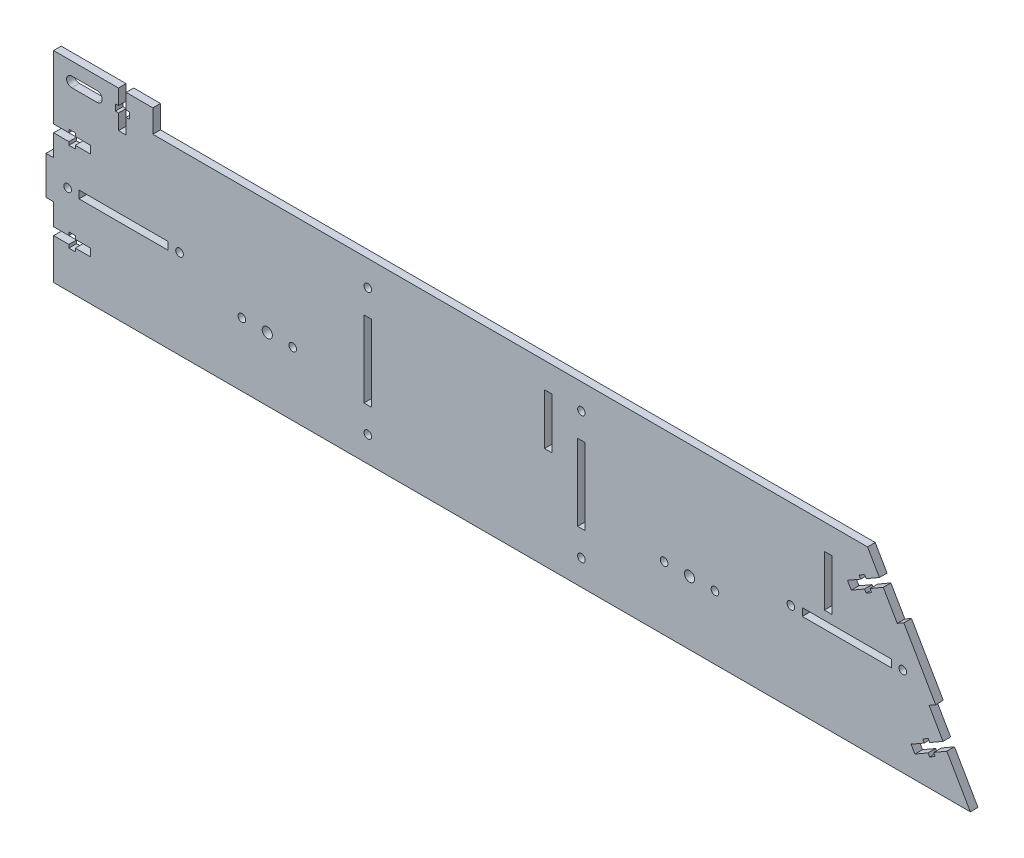
from build123d import *

# Parameters (mm, degrees)
SKETCH_1_R             = 2
SKETCH_1_R_2           = 1.5
EXTRUDE_1_DEPTH        = 3
SKETCH_2_W             = 19
SKETCH_2_H             = 3
EXTRUDE_2_DEPTH        = 3
PATTERN_LINEAR_1_COUNT = 9
PATTERN_LINEAR_1_PITCH = 28
SKETCH_3_W             = 3
SKETCH_3_H             = 30
CUT_EXTRUDE_1_DEPTH    = 3
SKETCH_4_W             = 35
SKETCH_4_H             = 3
CUT_EXTRUDE_2_DEPTH    = 3
SKETCH_5_R             = 1.5
CUT_EXTRUDE_3_DEPTH    = 3
CUT_EXTRUDE_4_DEPTH    = 3
CUT_EXTRUDE_5_DEPTH    = 3
SKETCH_8_W             = 39
SKETCH_8_H             = 3
EXTRUDE_3_DEPTH        = 9
SKETCH_11_W            = 3
SKETCH_11_H            = 25
EXTRUDE_5_DEPTH        = 3
SKETCH_12_W            = 3
SKETCH_12_H            = 15
EXTRUDE_6_DEPTH        = 3
SKETCH_13_W            = 243
SKETCH_13_H            = 3
CUT_EXTRUDE_7_DEPTH    = 3
SKETCH_14_W            = 3
SKETCH_14_H            = 20
CUT_EXTRUDE_8_DEPTH    = 10
CUT_EXTRUDE_9_DEPTH    = 3
CUT_EXTRUDE_10_DEPTH   = 10


with BuildPart() as part:
    # Эскиз1 → Бобышка-Вытянуть1 (new body)
    with BuildSketch(Plane.XY):
        Polygon((320, 70), (360.414518843, 0), (0, 0), (0, 70), align=None)
        with Locations((84, 25)):
            Circle(SKETCH_1_R, mode=Mode.SUBTRACT)
        with Locations((250, 25)):
            Circle(SKETCH_1_R, mode=Mode.SUBTRACT)
        with Locations((94, 25)):
            Circle(SKETCH_1_R_2, mode=Mode.SUBTRACT)
        with Locations((74, 25)):
            Circle(SKETCH_1_R_2, mode=Mode.SUBTRACT)
        with Locations((240, 25)):
            Circle(SKETCH_1_R_2, mode=Mode.SUBTRACT)
        with Locations((260, 25)):
            Circle(SKETCH_1_R_2, mode=Mode.SUBTRACT)
    extrude(amount=EXTRUDE_1_DEPTH)

    # Эскиз2 → Бобышка-Вытянуть2 (add)
    with BuildSketch(Plane(origin=(0, 70, 0), x_dir=(1, 0, 0), z_dir=(0, 1, 0))):
        with Locations((291.5, -1.5)):
            Rectangle(SKETCH_2_W, SKETCH_2_H)
    extrude_2 = extrude(amount=EXTRUDE_2_DEPTH)

    # Линейный массив1: Бобышка-Вытянуть2 ×9
    with Locations(*[(-i * PATTERN_LINEAR_1_PITCH, 0, 0) for i in range(1, PATTERN_LINEAR_1_COUNT)]):
        add(extrude_2)

    # Эскиз3 → Вырез-Вытянуть1 (cut)
    with BuildSketch(Plane.XY.offset(3)):
        with Locations((207.5, 35)):
            Rectangle(SKETCH_3_W, SKETCH_3_H)
        with Locations((123.5, 35)):
            Rectangle(SKETCH_3_W, SKETCH_3_H)
    extrude(amount=-CUT_EXTRUDE_1_DEPTH, mode=Mode.SUBTRACT)

    # Эскиз4 → Вырез-Вытянуть2 (cut)
    with BuildSketch(Plane.XY.offset(3)):
        with Locations((311.841234018, 35)):
            Rectangle(SKETCH_4_W, SKETCH_4_H)
        with Locations((27.5, 35)):
            Rectangle(SKETCH_4_W, SKETCH_4_H)
    extrude(amount=-CUT_EXTRUDE_2_DEPTH, mode=Mode.SUBTRACT)

    # Эскиз5 → Вырез-Вытянуть3 (cut)
    with BuildSketch(Plane.XY.offset(3)):
        with Locations((5.5, 35)):
            Circle(SKETCH_5_R)
        with Locations((49.5, 35)):
            Circle(SKETCH_5_R)
        with Locations((123.5, 60)):
            Circle(SKETCH_5_R)
        with Locations((123.5, 10)):
            Circle(SKETCH_5_R)
        with Locations((207.5, 60)):
            Circle(SKETCH_5_R)
        with Locations((207.5, 10)):
            Circle(SKETCH_5_R)
        with Locations((289.841234018, 35)):
            Circle(SKETCH_5_R)
        with Locations((333.841234018, 35)):
            Circle(SKETCH_5_R)
    extrude(amount=-CUT_EXTRUDE_3_DEPTH, mode=Mode.SUBTRACT)

    # Эскиз6 → Вырез-Вытянуть4 (cut)
    with BuildSketch(Plane.XY.offset(3)):
        Polygon((0, 54), (6, 54), (6, 55.25), (8.5, 55.25), (8.5, 54), (14.5, 54), (14.5, 51), (8.5, 51), (8.5, 49.75), (6, 49.75), (6, 51), (0, 51), align=None)
        Polygon((0, 19), (6, 19), (6, 20.25), (8.5, 20.25), (8.5, 19), (14.5, 19), (14.5, 16), (8.5, 16), (8.5, 14.75), (6, 14.75), (6, 16), (0, 16), align=None)
    extrude(amount=-CUT_EXTRUDE_4_DEPTH, mode=Mode.SUBTRACT)

    # Эскиз7 → Вырез-Вытянуть5 (cut)
    with BuildSketch(Plane.XY.offset(3)):
        Polygon((324.664518843, 61.920816371), (319.468366421, 58.920816371), (318.843366421, 60.003348125), (316.678302911, 58.753348125), (317.303302911, 57.670816371), (312.107150488, 54.670816371), (313.607150488, 52.072740159), (318.803302911, 55.072740159), (319.428302911, 53.990208405), (321.593366421, 55.240208405), (320.968366421, 56.322740159), (326.164518843, 59.322740159), align=None)
        Polygon((349.664518843, 18.619546181), (344.468366421, 15.619546181), (343.843366421, 16.702077936), (341.678302911, 15.452077936), (342.303302911, 14.369546181), (337.107150488, 11.369546181), (338.607150488, 8.77146997), (343.803302911, 11.77146997), (344.428302911, 10.688938215), (346.593366421, 11.938938215), (345.968366421, 13.02146997), (351.164518843, 16.02146997), align=None)
    extrude(amount=-CUT_EXTRUDE_5_DEPTH, mode=Mode.SUBTRACT)

    # Эскиз8 → Бобышка-Вытянуть3 (add)
    with BuildSketch(Plane(origin=(0, 70, 0), x_dir=(1, 0, 0), z_dir=(0, 1, 0))):
        with Locations((19.5, -1.5)):
            Rectangle(SKETCH_8_W, SKETCH_8_H)
    extrude(amount=EXTRUDE_3_DEPTH)

    # Эскиз11 → Бобышка-Вытянуть5 (add)
    with BuildSketch(Plane(origin=(270.310889132, 156.064064606, 0), x_dir=(0, 0, -1), z_dir=(0.8660254037844416, 0.4999999999999949, 0))):
        with Locations((-1.5, -135.207259422)):
            Rectangle(SKETCH_11_W, SKETCH_11_H)
    extrude(amount=EXTRUDE_5_DEPTH)

    # Эскиз12 → Бобышка-Вытянуть6 (add)
    with BuildSketch(Plane.ZY):
        with Locations((1.5, 35)):
            Rectangle(SKETCH_12_W, SKETCH_12_H)
    extrude(amount=EXTRUDE_6_DEPTH)

    # Эскиз13 → Вырез-Вытянуть7 (cut)
    with BuildSketch(Plane.XY.offset(3)):
        with Locations((179.5, 71.5)):
            Rectangle(SKETCH_13_W, SKETCH_13_H)
    extrude(amount=-CUT_EXTRUDE_7_DEPTH, mode=Mode.SUBTRACT)

    # Эскиз14 → Вырез-Вытянуть8 (cut)
    with BuildSketch(Plane.XY.offset(3)):
        with Locations((194.5, 50)):
            Rectangle(SKETCH_14_W, SKETCH_14_H)
        with Locations((304.5, 50)):
            Rectangle(SKETCH_14_W, SKETCH_14_H)
    extrude(amount=-CUT_EXTRUDE_8_DEPTH, mode=Mode.SUBTRACT)

    # Эскиз15 → Вырез-Вытянуть9 (cut)
    with BuildSketch(Plane.XY.offset(3)):
        Polygon((25.5, 79), (25.5, 73), (24.25, 73), (24.25, 70.5), (25.5, 70.5), (25.5, 64.5), (28.5, 64.5), (28.5, 70.5), (29.75, 70.5), (29.75, 73), (28.5, 73), (28.5, 79), align=None)
    extrude(amount=-CUT_EXTRUDE_9_DEPTH, mode=Mode.SUBTRACT)

    # Эскиз16 → Вырез-Вытянуть10 (cut)
    with BuildSketch(Plane.XY.offset(3)):
        with BuildLine():
            Line((7.094858998, 73.898901738), (17.094858998, 73.898901738))
            ThreePointArc((17.094858998, 73.898901738), (19.094858998, 71.898901738), (17.094858998, 69.898901738))
            Line((17.094858998, 69.898901738), (7.094858998, 69.898901738))
            ThreePointArc((7.094858998, 69.898901738), (5.094858998, 71.898901738), (7.094858998, 73.898901738))
        make_face()
    extrude(amount=-CUT_EXTRUDE_10_DEPTH, mode=Mode.SUBTRACT)


solid = part.part
